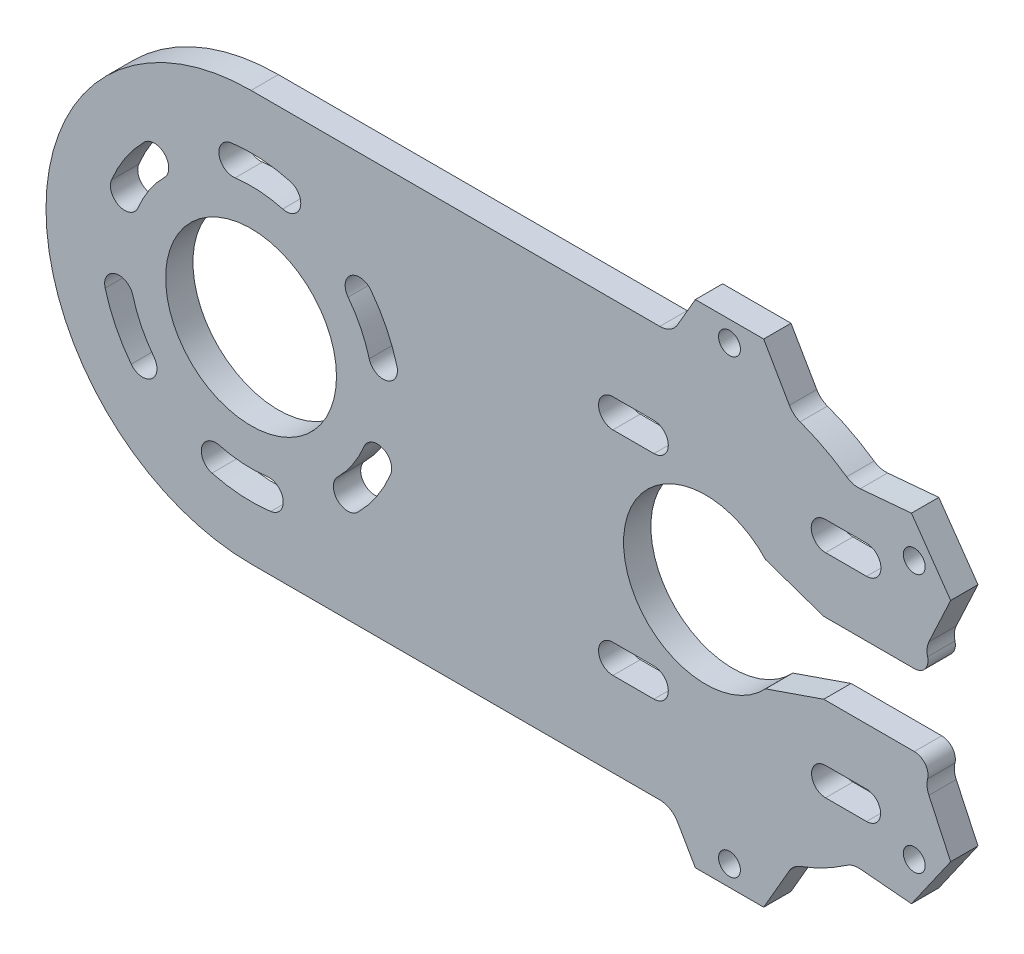
from build123d import *

# Parameters (mm, degrees)
SKIZZE1_R                       = 1.6
SKIZZE1_R_2                     = 12.5
AUFSATZ_LINEAR_AUSTRAGEN1_DEPTH = 4


with BuildPart() as part:
    # Skizze1 → Aufsatz-Linear austragen1 (new body)
    with BuildSketch(Plane.XY):
        with BuildLine():
            Line((60.618791136, -25.122399911), (53.121982765, -24.466514166))
            ThreePointArc((53.121982765, -24.466514166), (52.087524265, -24.556394327), (51.145668645, -24.99353369))
            ThreePointArc((51.145668645, -24.99353369), (47.84965812, -26.988212977), (44.325198534, -28.544045699))
            ThreePointArc((44.325198534, -28.544045699), (43.426888741, -29.064835818), (42.759922204, -29.860661471))
            Line((42.759922204, -29.860661471), (38.997199723, -36.377887981))
            Line((38.997199723, -36.377887981), (28.997199723, -36.377887981))
            Line((28.997199723, -36.377887981), (26.399123512, -31.877887981))
            ThreePointArc((26.399123512, -31.877887981), (25.301047301, -30.77981177), (23.801047301, -30.377887981))
            Line((23.801047301, -30.377887981), (-36.002800277, -30.377887981))
            ThreePointArc((-36.002800277, -30.377887981), (-66.002800277, -0.377887981), (-36.002800277, 29.622112019))
            Line((-36.002800277, 29.622112019), (23.801047301, 29.622112019))
            ThreePointArc((23.801047301, 29.622112019), (25.301047301, 30.024035807), (26.399123512, 31.122112019))
            Line((26.399123512, 31.122112019), (28.997199723, 35.622112019))
            Line((28.997199723, 35.622112019), (38.997199723, 35.622112019))
            Line((38.997199723, 35.622112019), (42.759922204, 29.104885508))
            ThreePointArc((42.759922204, 29.104885508), (43.426888741, 28.309059855), (44.325198534, 27.788269736))
            ThreePointArc((44.325198534, 27.788269736), (47.84965812, 26.232437014), (51.145668645, 24.237757727))
            ThreePointArc((51.145668645, 24.237757727), (52.087524265, 23.800618365), (53.121982765, 23.710738204))
            Line((53.121982765, 23.710738204), (60.618791136, 24.366623949))
            Line((60.618791136, 24.366623949), (66.3545555, 16.175103506))
            Line((66.3545555, 16.175103506), (63.173776116, 9.353900106))
            ThreePointArc((63.173776116, 9.353900106), (62.906383033, 8.372251699), (62.982460357, 7.357685339))
            ThreePointArc((62.982460357, 7.357685339), (62.618871056, 5.641491574), (61.042300943, 4.872112019))
            Line((61.042300943, 4.872112019), (47.785287356, 4.872112019))
            Line((47.785287356, 4.872112019), (39.265024534, 7.815111963))
            ThreePointArc((39.265024534, 7.815111963), (18.497199723, -0.377887981), (39.265024534, -8.570887926))
            Line((39.265024534, -8.570887926), (47.785287356, -5.627887981))
            Line((47.785287356, -5.627887981), (61.042300943, -5.627887981))
            ThreePointArc((61.042300943, -5.627887981), (62.618871056, -6.397267536), (62.982460357, -8.113461302))
            ThreePointArc((62.982460357, -8.113461302), (62.906383033, -9.128027661), (63.173776116, -10.109676068))
            Line((63.173776116, -10.109676068), (66.3545555, -16.930879469))
            Line((66.3545555, -16.930879469), (60.618791136, -25.122399911))
        make_face()
        with Locations((61.029217185, -19.305910381)):
            Circle(SKIZZE1_R, mode=Mode.SUBTRACT)
        with Locations((33.997199723, -33.377887981)):
            Circle(SKIZZE1_R, mode=Mode.SUBTRACT)
        with Locations((-36.002800277, -0.377887981)):
            Circle(SKIZZE1_R_2, mode=Mode.SUBTRACT)
        with Locations((61.029217185, 18.550134418)):
            Circle(SKIZZE1_R, mode=Mode.SUBTRACT)
        with Locations((33.997199723, 32.622112019)):
            Circle(SKIZZE1_R, mode=Mode.SUBTRACT)
        with BuildLine():
            Line((54.05354891, -13.884237167), (48.05354891, -13.884237167))
            ThreePointArc((48.05354891, -13.884237167), (46.00354891, -15.934237167), (48.05354891, -17.984237167))
            Line((48.05354891, -17.984237167), (54.05354891, -17.984237167))
            ThreePointArc((54.05354891, -17.984237167), (56.10354891, -15.934237167), (54.05354891, -13.884237167))
        make_face(mode=Mode.SUBTRACT)
        with BuildLine():
            Line((22.940850537, -13.834237167), (16.940850537, -13.834237167))
            ThreePointArc((16.940850537, -13.834237167), (14.840850537, -15.934237167), (16.940850537, -18.034237167))
            Line((16.940850537, -18.034237167), (22.940850537, -18.034237167))
            ThreePointArc((22.940850537, -18.034237167), (25.040850537, -15.934237167), (22.940850537, -13.834237167))
        make_face(mode=Mode.SUBTRACT)
        with BuildLine():
            Line((54.05354891, 17.278461205), (48.05354891, 17.278461205))
            ThreePointArc((48.05354891, 17.278461205), (45.95354891, 15.178461205), (48.05354891, 13.078461205))
            Line((48.05354891, 13.078461205), (54.05354891, 13.078461205))
            ThreePointArc((54.05354891, 13.078461205), (56.15354891, 15.178461205), (54.05354891, 17.278461205))
        make_face(mode=Mode.SUBTRACT)
        with BuildLine():
            Line((22.940850537, 17.278461205), (16.940850537, 17.278461205))
            ThreePointArc((16.940850537, 17.278461205), (14.840850537, 15.178461205), (16.940850537, 13.078461205))
            Line((16.940850537, 13.078461205), (22.940850537, 13.078461205))
            ThreePointArc((22.940850537, 13.078461205), (25.040850537, 15.178461205), (22.940850537, 17.278461205))
        make_face(mode=Mode.SUBTRACT)
        with BuildLine():
            ThreePointArc((-40.635661184, -17.667960272), (-37.17351629, -18.239562707), (-33.666381436, -18.124751))
            ThreePointArc((-33.666381436, -18.124751), (-31.310242223, -19.932680205), (-33.118171429, -22.288819418))
            ThreePointArc((-33.118171429, -22.288819418), (-37.448209433, -22.430570185), (-41.722701173, -21.724848742))
            ThreePointArc((-41.722701173, -21.724848742), (-43.207625414, -19.152884512), (-40.635661184, -17.667960272))
        make_face(mode=Mode.SUBTRACT)
        with BuildLine():
            ThreePointArc((-20.375740412, -16.004947846), (-17.627321845, -12.655990131), (-15.585062608, -8.835191837))
            ThreePointArc((-15.585062608, -8.835191837), (-16.721574418, -6.09140961), (-19.465356645, -7.227921421))
            ThreePointArc((-19.465356645, -7.227921421), (-21.119494216, -10.322595152), (-23.345588893, -13.035099365))
            ThreePointArc((-23.345588893, -13.035099365), (-23.345588893, -16.004947846), (-20.375740412, -16.004947846))
        make_face(mode=Mode.SUBTRACT)
        with BuildLine():
            ThreePointArc((-53.535909097, -13.831515562), (-50.591468081, -14.219158576), (-50.203825068, -11.274717561))
            ThreePointArc((-50.203825068, -11.274717561), (-52.05682235, -8.294855536), (-53.292872567, -5.010748889))
            ThreePointArc((-53.292872567, -5.010748889), (-55.864836797, -3.525824648), (-57.349761038, -6.097788878))
            ThreePointArc((-57.349761038, -6.097788878), (-55.823687864, -10.152468035), (-53.535909097, -13.831515562))
        make_face(mode=Mode.SUBTRACT)
        with BuildLine():
            ThreePointArc((-14.655839516, 5.342012915), (-16.181912689, 9.396692073), (-18.469691456, 13.0757396))
            ThreePointArc((-18.469691456, 13.0757396), (-21.414132472, 13.463382613), (-21.801775485, 10.518941598))
            ThreePointArc((-21.801775485, 10.518941598), (-19.948778203, 7.539079574), (-18.712727986, 4.254972926))
            ThreePointArc((-18.712727986, 4.254972926), (-16.140763756, 2.770048686), (-14.655839516, 5.342012915))
        make_face(mode=Mode.SUBTRACT)
        with BuildLine():
            ThreePointArc((-48.66001166, 12.279323402), (-50.886106337, 9.56681919), (-52.540243909, 6.472145458))
            ThreePointArc((-52.540243909, 6.472145458), (-55.284026135, 5.335633648), (-56.420537945, 8.079415874))
            ThreePointArc((-56.420537945, 8.079415874), (-54.378278708, 11.900214168), (-51.629860141, 15.249171883))
            ThreePointArc((-51.629860141, 15.249171883), (-48.66001166, 15.249171883), (-48.66001166, 12.279323402))
        make_face(mode=Mode.SUBTRACT)
        with BuildLine():
            ThreePointArc((-38.887429125, 21.533043455), (-40.69535833, 19.176904242), (-38.339219117, 17.368975037))
            ThreePointArc((-38.339219117, 17.368975037), (-34.832084263, 17.483786745), (-31.369939369, 16.912184309))
            ThreePointArc((-31.369939369, 16.912184309), (-28.797975139, 18.39710855), (-30.28289938, 20.96907278))
            ThreePointArc((-30.28289938, 20.96907278), (-34.557391121, 21.674794222), (-38.887429125, 21.533043455))
        make_face(mode=Mode.SUBTRACT)
    extrude(amount=AUFSATZ_LINEAR_AUSTRAGEN1_DEPTH)


solid = part.part
